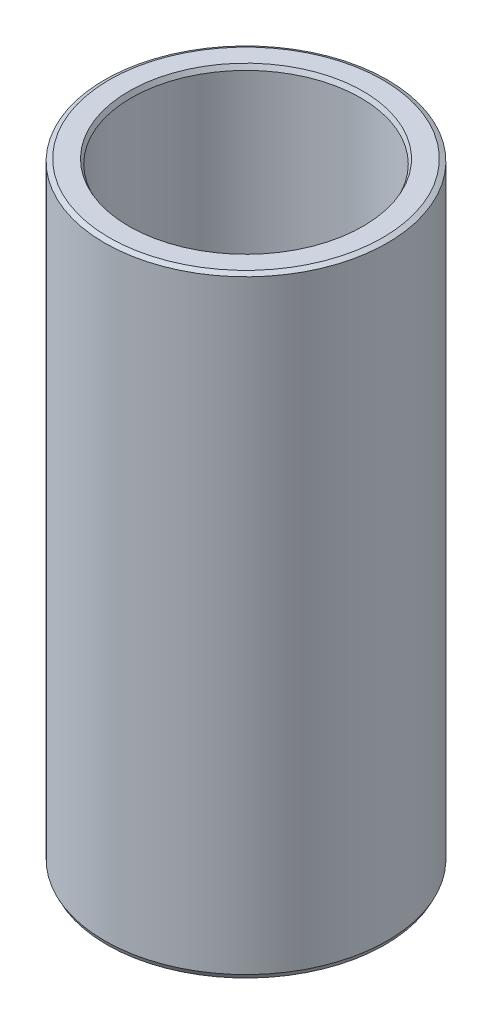
from build123d import *
from OCP.BRepFilletAPI import BRepFilletAPI_MakeChamfer

# Parameters (mm, degrees)
SKETCH1_R           = 45
BOSS_EXTRUDE1_DEPTH = 194.565541367
SKETCH2_R           = 36.529381327
CUT_EXTRUDE1_DEPTH  = 205.708939441
CHAMFER1_SIZE       = 0.733776757
CHAMFER1_SIZE2      = 1.474064316


with BuildPart() as part:
    # Sketch1 → Boss-Extrude1 (new body)
    with BuildSketch(Plane(origin=(0, 0, 0), x_dir=(1, 0, 0), z_dir=(0, 1, 0))):
        Circle(SKETCH1_R)
    extrude(amount=BOSS_EXTRUDE1_DEPTH)

    # Sketch2 → Cut-Extrude1 (cut, through all)
    with BuildSketch(Plane(origin=(0, 0, 0), x_dir=(1, 0, 0), z_dir=(0, 1, 0))):
        Circle(SKETCH2_R)
    extrude(amount=CUT_EXTRUDE1_DEPTH, mode=Mode.SUBTRACT)

    # Chamfer1: one chamfer whose edges measure the first distance from different faces: ONE call of the kernel's chamfer builder (chamfer() names one face for all edges)
    chamfer1_edges_1 = [part.edges().sort_by_distance(p)[0] for p in [
        (-36.529381327, 194.565541367, 0),
    ]]
    chamfer1_side_1 = [part.faces().sort_by_distance(p)[0] for p in [
        (-43.727207794, 194.565541367, 0),
    ]]
    chamfer1_edges_2 = [part.edges().sort_by_distance(p)[0] for p in [
        (-36.529381327, 0, 0),
    ]]
    chamfer1_side_2 = [part.faces().sort_by_distance(p)[0] for p in [
        (-36.529381327, 97.282770683, 0),
    ]]
    chamfer1_edges_3 = [part.edges().sort_by_distance(p)[0] for p in [
        (-45, 0, 0),
    ]]
    chamfer1_side_3 = [part.faces().sort_by_distance(p)[0] for p in [
        (-43.727207794, 0, 0),
    ]]
    chamfer1_edges_4 = [part.edges().sort_by_distance(p)[0] for p in [
        (-45, 194.565541367, 0),
    ]]
    chamfer1_side_4 = [part.faces().sort_by_distance(p)[0] for p in [
        (-45, 97.282770683, 0),
    ]]
    chamfer1 = BRepFilletAPI_MakeChamfer(part.part.solid().wrapped)
    for e in chamfer1_edges_1:
        chamfer1.Add(CHAMFER1_SIZE, CHAMFER1_SIZE2, e.wrapped, chamfer1_side_1[0].wrapped)  # the first distance lies on this face
    for e in chamfer1_edges_2:
        chamfer1.Add(CHAMFER1_SIZE, CHAMFER1_SIZE2, e.wrapped, chamfer1_side_2[0].wrapped)  # the first distance lies on this face
    for e in chamfer1_edges_3:
        chamfer1.Add(CHAMFER1_SIZE, CHAMFER1_SIZE2, e.wrapped, chamfer1_side_3[0].wrapped)  # the first distance lies on this face
    for e in chamfer1_edges_4:
        chamfer1.Add(CHAMFER1_SIZE, CHAMFER1_SIZE2, e.wrapped, chamfer1_side_4[0].wrapped)  # the first distance lies on this face
    add(Compound.cast(chamfer1.Shape()), mode=Mode.REPLACE)


solid = part.part
